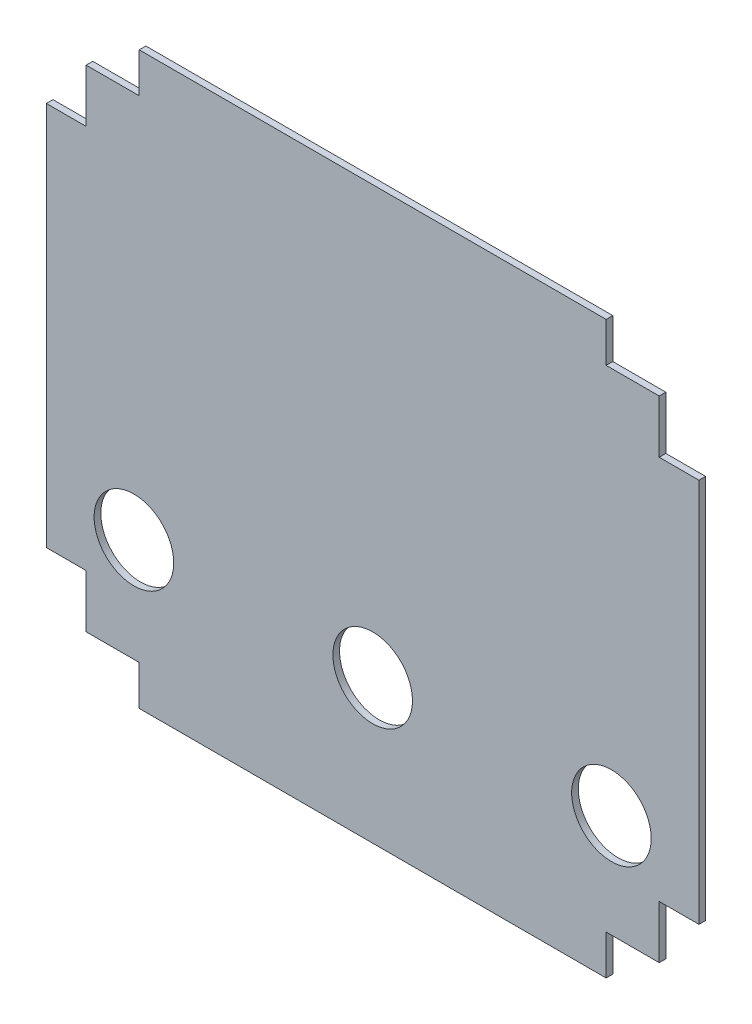
from build123d import *

# Parameters (mm, degrees)
SALIENTE_EXTRUIR1_DEPTH = 5
CROQUIS2_R              = 30
CORTAR_EXTRUIR1_DEPTH   = 10


with BuildPart() as part:
    # Croquis1 → Saliente-Extruir1 (new body)
    with BuildSketch(Plane.XY):
        Polygon((-246, 145), (-246, -145), (-216, -145), (-216, -185), (-176, -185), (-176, -215), (176, -215), (176, -185), (216, -185), (216, -145), (246, -145), (246, 145), (216, 145), (216, 185), (176, 185), (176, 215), (-176, 215), (-176, 185), (-216, 185), (-216, 145), align=None)
    extrude(amount=SALIENTE_EXTRUIR1_DEPTH)

    # Croquis2 → Cortar-Extruir1 (cut)
    with BuildSketch(Plane.XY.offset(5)):
        with Locations((-180, -107)):
            Circle(CROQUIS2_R)
        with Locations((0, -107)):
            Circle(CROQUIS2_R)
        with Locations((180, -107)):
            Circle(CROQUIS2_R)
    extrude(amount=-CORTAR_EXTRUIR1_DEPTH, mode=Mode.SUBTRACT)


solid = part.part
